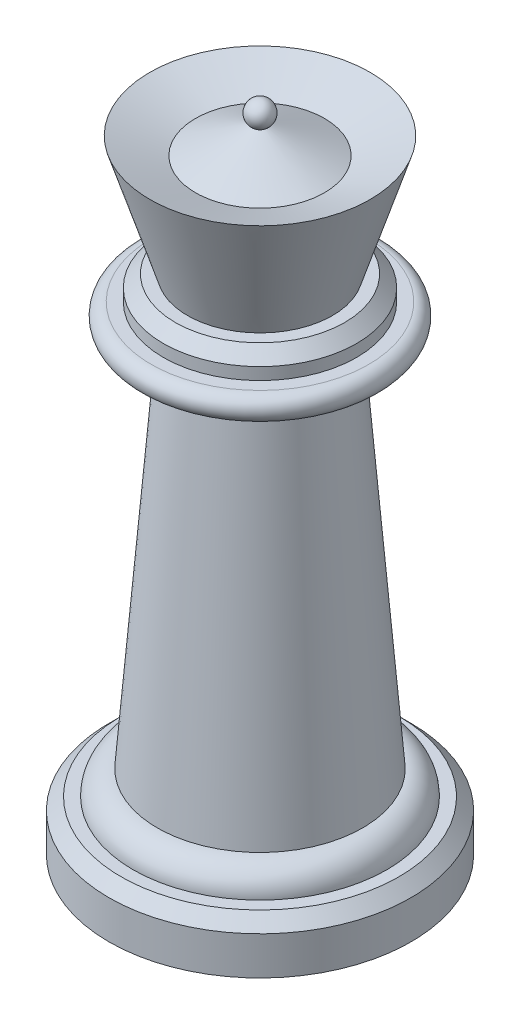
from build123d import *

# Parameters (mm, degrees)
FILLET1_R     = 1.524
CHAMFER1_SIZE = 0.762
CHAMFER2_SIZE = 0.762


with BuildPart() as part:
    # Sketch2 → Revolve1 (revolve)
    with BuildSketch(Plane.XY, mode=Mode.PRIVATE) as revolve1_sk:
        with BuildLine():
            Line((0, 0), (0, 41.275))
            ThreePointArc((0, 41.275), (-0.736350012, 40.709042493), (-0.378886857, 39.851873121))
            Line((-0.378886857, 39.851873121), (-4.064, 38.179030904))
            Line((-4.064, 38.179030904), (-6.946791529, 39.254381297))
            Line((-6.946791529, 39.254381297), (-4.572, 31.7246))
            Line((-4.572, 31.7246), (-6.096, 31.7246))
            Line((-6.096, 31.7246), (-6.096, 30.2006))
            Line((-6.096, 30.2006), (-6.858, 30.2006))
            ThreePointArc((-6.858, 30.2006), (-7.62, 29.4386), (-6.858, 28.6766))
            Line((-6.858, 28.6766), (-4.572, 28.6766))
            Line((-4.572, 28.6766), (-6.477, 4.699))
            Line((-6.477, 4.699), (-8.001, 4.699))
            Line((-8.001, 4.699), (-8.001, 3.175))
            Line((-8.001, 3.175), (-9.525, 3.175))
            Line((-9.525, 3.175), (-9.525, 0))
            Line((-9.525, 0), (0, 0))
        make_face()
    revolve(revolve1_sk.sketch.rotate(Axis((0, 0, 0), (0, 1, 0)), 270), axis=Axis((0, 0, 0), (0, 1, 0)))

    # Fillet1
    fillet1_edges = [part.edges().sort_by_distance(p)[0] for p in [
        (0, 4.699, 8.001),
    ]]
    fillet(fillet1_edges, radius=FILLET1_R - 0.0001)  # a hair under: the kernel refuses the full size

    # Chamfer1
    chamfer1_edges = [part.edges().sort_by_distance(p)[0] for p in [
        (0, 3.175, 9.525),
    ]]
    chamfer(chamfer1_edges, length=CHAMFER1_SIZE)

    # Chamfer2
    chamfer2_edges = [part.edges().sort_by_distance(p)[0] for p in [
        (0, 31.7246, 6.096),
    ]]
    chamfer(chamfer2_edges, length=CHAMFER2_SIZE)


solid = part.part
